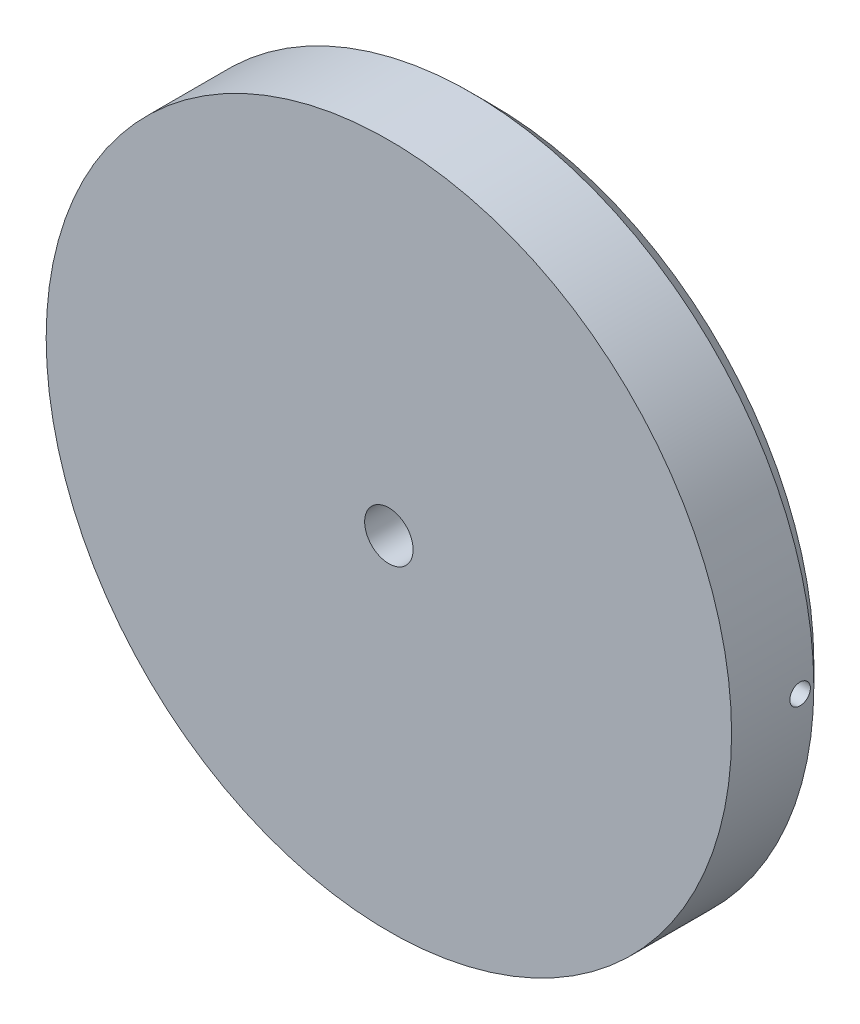
from build123d import *

# Parameters (mm, degrees)
BOSS_EXTRUDE1_DEPTH             = 10
BOSS_EXTRUDE1_DEPTH_BACK        = 5
SKETCH1_R                       = 50
SKETCH1_R_2                     = 3.535
SKETCH2_R                       = 1.5
CUT_EXTRUDE1_DEPTH              = 72.414284285
SKETCH3_R                       = 1.5
CUT_EXTRUDE2_DEPTH              = 72.414284444
CHAMFER1_SIZE                   = 3
BOSS_EXTRUDE2_REACH             = 73.414
SKETCH4_R                       = 35
SKETCH4_R_2                     = 3.535
BOSS_EXTRUDE2_DIRECTION_2_REACH = 73.414


with BuildPart() as part:
    # Sketch1 → Boss-Extrude1 (new, two sides: drawn at the far end of the back side and taken through both)
    with BuildSketch(Plane.XY.offset(-BOSS_EXTRUDE1_DEPTH_BACK)):
        Circle(SKETCH1_R)
        Circle(SKETCH1_R_2, mode=Mode.SUBTRACT)
    extrude(amount=BOSS_EXTRUDE1_DEPTH + BOSS_EXTRUDE1_DEPTH_BACK)

    # Sketch2 → Cut-Extrude1 (cut, through all)
    with BuildSketch(Plane(origin=(0, 0, 0), x_dir=(1, 0, 0), z_dir=(0, 1, 0))):
        Circle(SKETCH2_R)
    extrude(amount=-CUT_EXTRUDE1_DEPTH, mode=Mode.SUBTRACT)

    # Sketch3 → Cut-Extrude2 (cut, through all)
    with BuildSketch(Plane(origin=(0, 0, 0), x_dir=(0, 0, -1), z_dir=(1, 0, 0))):
        Circle(SKETCH3_R)
    extrude(amount=CUT_EXTRUDE2_DEPTH, mode=Mode.SUBTRACT)

    # Chamfer1
    chamfer1_edges = [part.edges().sort_by_distance(p)[0] for p in [
        (-50, 0, -5),
    ]]
    chamfer(chamfer1_edges, length=CHAMFER1_SIZE)

    # Boss-Extrude2: up to this face of the body (flat: up to its plane)
    boss_extrude2_end = Plane(part.part.faces().sort_by_distance((-48.585786438, 0, 10))[0])
    # Sketch4 → Boss-Extrude2 (add, up to the picked face)
    with BuildSketch(Plane.XY, mode=Mode.PRIVATE) as boss_extrude2_sk1:
        Circle(SKETCH4_R)
        Circle(SKETCH4_R_2, mode=Mode.SUBTRACT)
    boss_extrude2_tool1 = split(extrude(boss_extrude2_sk1.sketch, amount=BOSS_EXTRUDE2_REACH, mode=Mode.PRIVATE), bisect_by=boss_extrude2_end, keep=Keep.BOTH, mode=Mode.PRIVATE)
    add(boss_extrude2_tool1.solids().sort_by(Axis((-34.010051, 0, 0), (0, 0, 1)))[0])

    # Boss-Extrude2 direction 2: up to this face of the body (flat: up to its plane)
    boss_extrude2_direction_2_end = Plane(part.part.faces().sort_by_distance((-45.670639251, 0, -5))[0])
    # Sketch4 → Boss-Extrude2 direction 2 (add, up to the picked face)
    with BuildSketch(Plane.XY, mode=Mode.PRIVATE) as boss_extrude2_direction_2_sk1:
        Circle(SKETCH4_R)
        Circle(SKETCH4_R_2, mode=Mode.SUBTRACT)
    boss_extrude2_direction_2_tool1 = split(extrude(boss_extrude2_direction_2_sk1.sketch, amount=-BOSS_EXTRUDE2_DIRECTION_2_REACH, mode=Mode.PRIVATE), bisect_by=boss_extrude2_direction_2_end, keep=Keep.BOTH, mode=Mode.PRIVATE)
    add(boss_extrude2_direction_2_tool1.solids().sort_by(Axis((-34.010051, 0, 0), (0, 0, -1)))[0])


solid = part.part
